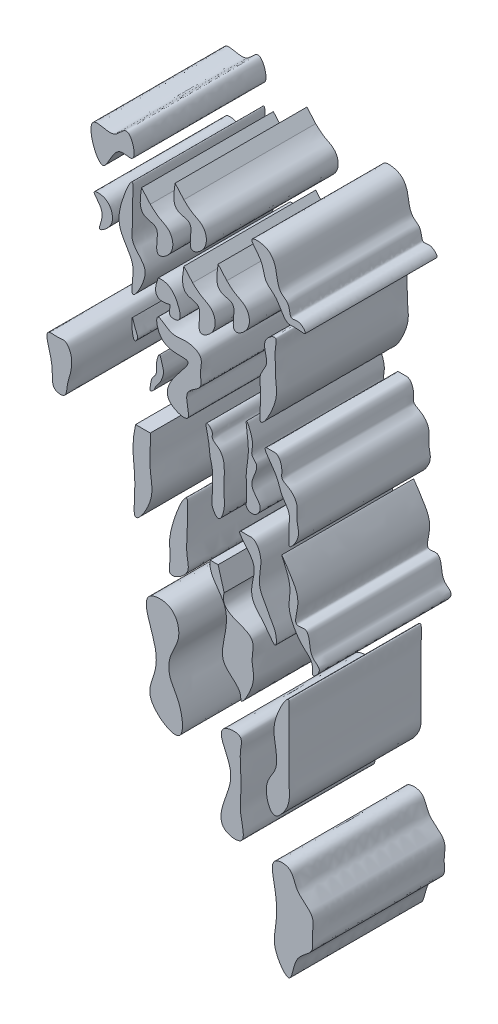
from build123d import *

# Parameters (mm, degrees)
BOSS_EXTRUDE1_DEPTH    = 4
BOSS_EXTRUDE1_2_DEPTH  = 4
BOSS_EXTRUDE1_3_DEPTH  = 4
BOSS_EXTRUDE1_4_DEPTH  = 4
BOSS_EXTRUDE1_5_DEPTH  = 4
BOSS_EXTRUDE1_6_DEPTH  = 4
BOSS_EXTRUDE1_7_DEPTH  = 4
BOSS_EXTRUDE1_8_DEPTH  = 4
BOSS_EXTRUDE1_9_DEPTH  = 4
BOSS_EXTRUDE1_10_DEPTH = 4
BOSS_EXTRUDE1_11_DEPTH = 4
BOSS_EXTRUDE1_12_DEPTH = 4
BOSS_EXTRUDE1_13_DEPTH = 4
BOSS_EXTRUDE1_14_DEPTH = 4
BOSS_EXTRUDE1_15_DEPTH = 4
BOSS_EXTRUDE1_16_DEPTH = 4
BOSS_EXTRUDE1_17_DEPTH = 4
BOSS_EXTRUDE1_18_DEPTH = 4
BOSS_EXTRUDE1_19_DEPTH = 4
BOSS_EXTRUDE1_20_DEPTH = 4
BOSS_EXTRUDE1_21_DEPTH = 4
BOSS_EXTRUDE1_22_DEPTH = 4
BOSS_EXTRUDE1_23_DEPTH = 4
BOSS_EXTRUDE1_24_DEPTH = 4
BOSS_EXTRUDE1_25_DEPTH = 4
BOSS_EXTRUDE1_26_DEPTH = 4


with BuildPart() as part:
    # Sketch2 → Boss-Extrude1 (new body)
    with BuildSketch(Plane.XY):
        with BuildLine():
            Line((-21.986335462, -41.867078251), (-22.252383941, -41.563360809))
            add(Edge.make_bspline(
                [(-22.252383941, -41.563360809), (-22.298472315, -41.861578773), (-22.366610204, -42.302469624), (-21.719633435, -42.325520445), (-21.795140074, -42.723708569), (-21.801445987, -43.195240069), (-21.218247997, -42.82832349), (-21.319505384, -42.245709932), (-21.745198937, -42.096377794), (-21.911165814, -41.938557948), (-21.986335462, -41.867078251)],
                knots=[0, 0, 0, 0, 0.207427307, 0.306664296, 0.423391703, 0.50552082, 0.625102619, 0.799711517, 0.909285425, 1, 1, 1, 1], degree=3))
        make_face()
    extrude(amount=BOSS_EXTRUDE1_DEPTH)


with BuildPart() as body_2:
    # Sketch2 → Boss-Extrude1 2 (new body)
    with BuildSketch(Plane.XY):
        with BuildLine():
            Line((-19.662457453, -42.71461023), (-19.928505932, -42.410892789))
            add(Edge.make_bspline(
                [(-19.928505932, -42.410892789), (-19.974594306, -42.709110752), (-20.042732194, -43.150001603), (-19.395755426, -43.173052425), (-19.471262065, -43.571240548), (-19.477567978, -44.042772048), (-18.894369988, -43.67585547), (-18.995627374, -43.093241911), (-19.421320928, -42.943909773), (-19.587287805, -42.786089928), (-19.662457453, -42.71461023)],
                knots=[0, 0, 0, 0, 0.207427307, 0.306664296, 0.423391703, 0.50552082, 0.625102619, 0.799711517, 0.909285425, 1, 1, 1, 1], degree=3))
        make_face()
    extrude(amount=BOSS_EXTRUDE1_2_DEPTH)


with BuildPart() as body_3:
    # Sketch2 → Boss-Extrude1 3 (new body)
    with BuildSketch(Plane.XY):
        with BuildLine():
            Line((-20.701367621, -43.288744797), (-20.967416101, -42.985027356))
            add(Edge.make_bspline(
                [(-20.967416101, -42.985027356), (-21.013504475, -43.283245319), (-21.081642363, -43.72413617), (-20.434665595, -43.747186992), (-20.510172234, -44.145375115), (-20.516478147, -44.616906615), (-19.933280157, -44.249990036), (-20.034537543, -43.667376478), (-20.460231096, -43.51804434), (-20.626197974, -43.360224495), (-20.701367621, -43.288744797)],
                knots=[0, 0, 0, 0, 0.207427307, 0.306664296, 0.423391703, 0.50552082, 0.625102619, 0.799711517, 0.909285425, 1, 1, 1, 1], degree=3))
        make_face()
    extrude(amount=BOSS_EXTRUDE1_3_DEPTH)


with BuildPart() as body_4:
    # Sketch2 → Boss-Extrude1 4 (new body)
    with BuildSketch(Plane.XY):
        with BuildLine():
            Line((-20.967416101, -41.238808198), (-21.23346458, -40.935090757))
            add(Edge.make_bspline(
                [(-21.23346458, -40.935090757), (-21.279552954, -41.23330872), (-21.347690843, -41.674199571), (-20.700714074, -41.697250393), (-20.776220713, -42.095438516), (-20.782526626, -42.566970016), (-20.199328636, -42.200053437), (-20.300586022, -41.617439879), (-20.726279576, -41.468107741), (-20.892246453, -41.310287895), (-20.967416101, -41.238808198)],
                knots=[0, 0, 0, 0, 0.207427307, 0.306664296, 0.423391703, 0.50552082, 0.625102619, 0.799711517, 0.909285425, 1, 1, 1, 1], degree=3))
        make_face()
    extrude(amount=BOSS_EXTRUDE1_4_DEPTH)


with BuildPart() as body_5:
    # Sketch2 → Boss-Extrude1 5 (new body)
    with BuildSketch(Plane.XY):
        with BuildLine():
            add(Edge.make_bspline(
                [(-23.68118214, -42.382997305), (-23.737073321, -42.439817834), (-23.257102059, -42.75520643), (-23.70139795, -43.471427128), (-23.175643709, -43.083143681), (-23.094900473, -42.726017087), (-23.271418547, -42.345807041), (-23.647460778, -42.348715231), (-23.68118214, -42.382997305)],
                knots=[0, 0, 0, 0, 0.189662322, 0.403883418, 0.562625618, 0.683862046, 0.885569215, 1, 1, 1, 1], degree=3))
        make_face()
    extrude(amount=BOSS_EXTRUDE1_5_DEPTH)


with BuildPart() as body_6:
    # Sketch2 → Boss-Extrude1 6 (new body)
    with BuildSketch(Plane.XY):
        with BuildLine():
            add(Edge.make_bspline(
                [(-23.05236809, -40.555314666), (-22.921397326, -40.483411989), (-22.630328363, -39.999500735), (-22.321663146, -41.103780518), (-23.117307183, -40.754654029), (-23.392421337, -42.284527412), (-24.015844419, -40.483500593), (-23.386988809, -40.559869883), (-23.176617867, -40.623527534), (-23.05236809, -40.555314666)],
                knots=[0, 0, 0, 0, 0.110138294, 0.274977823, 0.358566911, 0.575411854, 0.839787582, 0.89551364, 1, 1, 1, 1], degree=3))
        make_face()
    extrude(amount=BOSS_EXTRUDE1_6_DEPTH)


with BuildPart() as body_7:
    # Sketch2 → Boss-Extrude1 7 (new body)
    with BuildSketch(Plane.XY):
        with BuildLine():
            add(Edge.make_bspline(
                [(-22.532913006, -41.563360809), (-22.590677573, -41.531299761), (-22.949670309, -42.366385654), (-22.969863341, -43.032278711), (-22.460213199, -43.62490225), (-22.525441776, -44.081256962), (-22.580252653, -44.783458591), (-22.140611049, -44.012472959), (-22.137117074, -43.483853196), (-22.590376996, -43.230805363), (-22.512895688, -42.687813561), (-22.559840411, -42.275462041), (-22.480600408, -41.592395853), (-22.532913006, -41.563360809)],
                knots=[0, 0, 0, 0, 0.124790419, 0.252828034, 0.367115678, 0.450340127, 0.495153292, 0.620686035, 0.639891678, 0.758950007, 0.803763172, 0.886987622, 1, 1, 1, 1], degree=3))
        make_face()
    extrude(amount=BOSS_EXTRUDE1_7_DEPTH)


with BuildPart() as body_8:
    # Sketch2 → Boss-Extrude1 8 (new body)
    with BuildSketch(Plane.XY):
        with BuildLine():
            add(Edge.make_bspline(
                [(-21.748218975, -44.710955341), (-21.837771198, -44.740020199), (-21.7045509, -45.555112282), (-20.381618381, -45.199229818), (-21.4324039, -46.092432465), (-21.533943, -46.826608735), (-20.588160681, -47.125043046), (-21.105450624, -46.174669673), (-20.366921925, -45.997889383), (-20.509655171, -45.520112635), (-20.344004421, -45.071355562), (-20.918926217, -44.860710179), (-21.331116078, -45.03678209), (-21.680083167, -44.688841344), (-21.748218975, -44.710955341)],
                knots=[0, 0, 0, 0, 0.079194782, 0.197262076, 0.345976518, 0.419153876, 0.501785608, 0.599355418, 0.681342851, 0.730127756, 0.795174296, 0.860690626, 0.939744652, 1, 1, 1, 1], degree=3))
        make_face()
    extrude(amount=BOSS_EXTRUDE1_8_DEPTH)


with BuildPart() as body_9:
    # Sketch2 → Boss-Extrude1 9 (new body)
    with BuildSketch(Plane.XY):
        with BuildLine():
            add(Edge.make_bspline(
                [(-21.748218975, -43.685605608), (-22.006178502, -44.380112028), (-21.391044245, -44.201524663)],
                knots=[0, 0, 0, 1, 1, 1], degree=2))
            add(Edge.make_bspline(
                [(-21.391044245, -44.201524663), (-21.376935261, -44.309191711), (-21.503090251, -44.52834963), (-21.099724893, -44.544041202), (-21.071615595, -44.297323078), (-21.170013448, -43.998550273), (-21.361421395, -43.669741319), (-21.713865543, -43.668881688), (-21.748218975, -43.685605608)],
                knots=[0.768268496, 0.768268496, 0.768268496, 0.768268496, 0.886892453, 1, 1.067007808, 1.163276486, 1.415120514, 1.50032429, 1.50032429, 1.50032429, 1.50032429], degree=3))
        make_face()
    extrude(amount=BOSS_EXTRUDE1_9_DEPTH)


with BuildPart() as body_10:
    # Sketch2 → Boss-Extrude1 10 (new body)
    with BuildSketch(Plane.XY):
        with BuildLine():
            add(Edge.make_bspline(
                [(-18.896727415, -41.238808198), (-18.943620198, -41.308831083), (-18.519259496, -41.666134083), (-18.566270998, -42.147998326), (-18.075173598, -42.420663017), (-17.918275253, -42.982314881), (-17.552256958, -42.886789115), (-17.165316303, -42.986307194), (-17.452171962, -42.639278286), (-17.773124988, -42.798677076), (-17.738789556, -42.375053958), (-18.142320304, -42.19653355), (-18.123301743, -41.645976786), (-18.387286933, -41.194914757), (-18.858289707, -41.181410896), (-18.896727415, -41.238808198)],
                knots=[0, 0, 0, 0, 0.090893699, 0.198006008, 0.271353317, 0.397553121, 0.445449175, 0.493345228, 0.547007653, 0.589581923, 0.652417314, 0.703549173, 0.825265733, 0.925495028, 1, 1, 1, 1], degree=3))
        make_face()
    extrude(amount=BOSS_EXTRUDE1_10_DEPTH)


with BuildPart() as body_11:
    # Sketch2 → Boss-Extrude1 11 (new body)
    with BuildSketch(Plane.XY):
        with BuildLine():
            add(Edge.make_bspline(
                [(-18.185894142, -43.487175203), (-18.231846745, -43.442826317), (-18.696190335, -43.73972167), (-18.296271874, -44.251640337), (-18.683251608, -44.618884044), (-18.632691542, -45.07538334), (-18.634453348, -45.405482102), (-18.707906436, -46.232988357), (-18.045273381, -45.095678607), (-18.1965189, -44.636713718), (-18.177645779, -44.146839604), (-18.227376303, -43.87954742), (-18.153914748, -43.518038536), (-18.185894142, -43.487175203)],
                knots=[0, 0, 0, 0, 0.061537795, 0.185612455, 0.277415397, 0.320071355, 0.442707231, 0.506691167, 0.681349602, 0.806503316, 0.845202652, 0.95717454, 1, 1, 1, 1], degree=3))
        make_face()
    extrude(amount=BOSS_EXTRUDE1_11_DEPTH)


with BuildPart() as body_12:
    # Sketch2 → Boss-Extrude1 12 (new body)
    with BuildSketch(Plane.XY):
        with BuildLine():
            add(Edge.make_bspline(
                [(-20.262482599, -46.761435937), (-20.334783729, -46.758471735), (-20.17961393, -47.241615252), (-20.205476149, -47.528984505), (-20.081023169, -47.892509102), (-20.11853295, -48.218240939), (-20.087094027, -48.550476956), (-20.154260695, -48.846121307), (-19.886248342, -49.248428962), (-19.715205788, -48.741327686), (-19.750240889, -48.468757583), (-19.741306449, -48.181545904), (-19.749927058, -47.899830726), (-19.722882301, -47.558773764), (-19.83967125, -47.241498524), (-20.143811383, -47.105659747), (-20.067698205, -46.891998812), (-20.218671108, -46.763232121), (-20.262482599, -46.761435937)],
                knots=[0, 0, 0, 0, 0.07553121, 0.170308288, 0.228109535, 0.293871514, 0.369028061, 0.425395472, 0.484490328, 0.565557313, 0.621924723, 0.672029088, 0.734659544, 0.794158477, 0.87802002, 0.927742579, 0.954231214, 1, 1, 1, 1], degree=3))
        make_face()
    extrude(amount=BOSS_EXTRUDE1_12_DEPTH)


with BuildPart() as body_13:
    # Sketch2 → Boss-Extrude1 13 (new body)
    with BuildSketch(Plane.XY):
        with BuildLine():
            add(Edge.make_bspline(
                [(-19.067166236, -46.104002927), (-19.095519908, -46.111793064), (-19.009798549, -46.635862487), (-18.999132189, -46.974030438), (-19.087420252, -47.450952273), (-19.073490808, -47.835114926), (-19.049031318, -48.146117899), (-19.102672106, -48.384734417), (-18.83150345, -48.523032912), (-18.492887741, -48.118434906), (-18.912888716, -47.872156886), (-18.900990897, -47.461061547), (-18.63791884, -47.134896533), (-18.929432785, -46.939520873), (-18.886841839, -46.720813288), (-18.866520812, -46.479944796), (-19.036413451, -46.095553636), (-19.067166236, -46.104002927)],
                knots=[0, 0, 0, 0, 0.079148829, 0.188966448, 0.25713944, 0.355437454, 0.416873712, 0.447591842, 0.486056184, 0.555274674, 0.659524401, 0.687170717, 0.79677169, 0.830363006, 0.862856249, 0.914154087, 1, 1, 1, 1], degree=3))
        make_face()
    extrude(amount=BOSS_EXTRUDE1_13_DEPTH)


with BuildPart() as body_14:
    # Sketch2 → Boss-Extrude1 14 (new body)
    with BuildSketch(Plane.XY):
        with BuildLine():
            add(Edge.make_bspline(
                [(-18.459291555, -46.502464629), (-18.607317053, -46.530797749), (-18.093786404, -47.065459578), (-18.057589687, -47.494817637), (-17.726759369, -47.836520005), (-17.79553672, -48.25605929), (-17.76253241, -48.499036775), (-17.794268937, -48.861617077), (-17.396031252, -48.355266718), (-17.547451973, -48.069052021), (-17.531506428, -47.774736449), (-17.517300163, -47.495978756), (-17.689892888, -47.231965709), (-18.02282498, -47.11622089), (-17.967653002, -46.81367542), (-18.068701293, -46.46634304), (-18.319292429, -46.509896128), (-18.426888488, -46.496262455), (-18.459291555, -46.502464629)],
                knots=[0, 0, 0, 0, 0.118684727, 0.212554465, 0.298046987, 0.357615413, 0.44101121, 0.458881738, 0.530348682, 0.619701322, 0.667356064, 0.694161856, 0.779853247, 0.833126039, 0.858319634, 0.947491069, 0.974019685, 1, 1, 1, 1], degree=3))
        make_face()
    extrude(amount=BOSS_EXTRUDE1_14_DEPTH)


with BuildPart() as body_15:
    # Sketch2 → Boss-Extrude1 15 (new body)
    with BuildSketch(Plane.XY):
        with BuildLine():
            add(Edge.make_bspline(
                [(-22.532945929, -45.121059609), (-22.569722647, -45.130350819), (-22.53625296, -45.91072222), (-22.342358304, -45.544330196), (-22.452874537, -45.392774724), (-22.512196327, -45.115923971), (-22.53293496, -45.121056838), (-22.532945929, -45.121059609)],
                knots=[0.514864485, 0.514864485, 0.514864485, 0.514864485, 1, 1.118853239, 1.24143454, 1.514719792, 1.514864485, 1.514864485, 1.514864485, 1.514864485], degree=3))
        make_face()
    extrude(amount=BOSS_EXTRUDE1_15_DEPTH)


with BuildPart() as body_16:
    # Sketch2 → Boss-Extrude1 16 (new body)
    with BuildSketch(Plane.XY):
        with BuildLine():
            add(Edge.make_bspline(
                [(-21.702473758, -45.684002753), (-21.732193882, -45.680148085), (-21.841585912, -45.988147379), (-21.749571569, -46.215523849), (-21.966529984, -46.429781527), (-21.970647929, -46.578174547), (-22.018439679, -46.804904697), (-21.859438898, -46.700882326), (-21.835927782, -46.558270765), (-21.698190557, -46.434370036), (-21.624025484, -46.25963168), (-21.561751102, -46.06635404), (-21.637064515, -45.901767284), (-21.673421357, -45.687770819), (-21.702473758, -45.684002753)],
                knots=[0, 0, 0, 0, 0.092912224, 0.25554589, 0.331586786, 0.430138251, 0.480228307, 0.526797268, 0.585231648, 0.673735129, 0.742868481, 0.830191707, 0.909175241, 1, 1, 1, 1], degree=3))
        make_face()
    extrude(amount=BOSS_EXTRUDE1_16_DEPTH)


with BuildPart() as body_17:
    # Sketch2 → Boss-Extrude1 17 (new body)
    with BuildSketch(Plane.XY):
        with BuildLine():
            add(Edge.make_bspline(
                [(-19.241242608, -49.088158003), (-19.385758358, -49.120645444), (-18.677205616, -49.702181463), (-18.90706467, -50.183012597), (-18.923729207, -50.806234643), (-18.571296533, -51.043232809), (-18.142196515, -51.737987706), (-18.159562193, -51.194176071), (-18.328322013, -50.973935337), (-18.47026966, -50.649161221), (-18.708325869, -50.312109744), (-18.653611492, -49.846193788), (-18.595742772, -49.433186777), (-18.811641683, -49.050871247), (-19.061524962, -49.098206697), (-19.203620137, -49.079700393), (-19.241242608, -49.088158003)],
                knots=[0, 0, 0, 0, 0.115157859, 0.226820089, 0.281142255, 0.413350591, 0.482986084, 0.53730825, 0.591136238, 0.642047568, 0.716172115, 0.797655364, 0.870084918, 0.940667278, 0.970020408, 1, 1, 1, 1], degree=3))
        make_face()
    extrude(amount=BOSS_EXTRUDE1_17_DEPTH)


with BuildPart() as body_18:
    # Sketch2 → Boss-Extrude1 18 (new body)
    with BuildSketch(Plane.XY):
        with BuildLine():
            add(Edge.make_bspline(
                [(-17.994515953, -49.088158003), (-18.024924398, -49.061644981), (-17.640209476, -49.765885274), (-17.863175831, -50.298997318), (-17.608596879, -50.891973877), (-17.293081927, -51.248881516), (-17.018382999, -51.446672462), (-17.117523428, -51.919377835), (-16.73947771, -51.528579654), (-17.119072763, -51.33766791), (-17.136902602, -51.026927405), (-17.217839312, -50.618892222), (-17.65615351, -50.785830169), (-17.416144317, -50.002405244), (-17.608703845, -49.672575848), (-17.974982474, -49.105189178), (-17.994515953, -49.088158003)],
                knots=[0, 0, 0, 0, 0.099615464, 0.20490965, 0.317531288, 0.378111709, 0.440135327, 0.477239873, 0.52570191, 0.566148169, 0.635447654, 0.682907344, 0.722866922, 0.785474276, 0.936009994, 1, 1, 1, 1], degree=3))
        make_face()
    extrude(amount=BOSS_EXTRUDE1_18_DEPTH)


with BuildPart() as body_19:
    # Sketch2 → Boss-Extrude1 19 (new body)
    with BuildSketch(Plane.XY):
        with BuildLine():
            add(Edge.make_bspline(
                [(-17.775798023, -52.797998542), (-17.838175988, -52.707112984), (-18.320718484, -53.5760396), (-18.188528499, -54.137311989), (-18.098552265, -54.871728047), (-18.612675551, -55.28980636), (-18.320503033, -56.218073651), (-17.908971472, -55.815098537), (-17.735048884, -55.459601542), (-17.78623335, -54.975676225), (-17.772114631, -54.493827783), (-17.777948091, -53.992204743), (-17.77269212, -53.566541807), (-17.781709454, -53.198357915), (-17.738405638, -52.852479763), (-17.775798023, -52.797998542)],
                knots=[0, 0, 0, 0, 0.117997798, 0.224098221, 0.30809439, 0.405103613, 0.506158499, 0.541785397, 0.615385964, 0.681698729, 0.748011494, 0.827586812, 0.902741278, 0.929266384, 1, 1, 1, 1], degree=3))
        make_face()
    extrude(amount=BOSS_EXTRUDE1_19_DEPTH)


with BuildPart() as body_20:
    # Sketch2 → Boss-Extrude1 20 (new body)
    with BuildSketch(Plane.XY):
        with BuildLine():
            Line((-19.928505932, -50.309603916), (-20.169436407, -50.309603916))
            add(Edge.make_bspline(
                [(-20.169436407, -50.309603916), (-20.229671124, -50.700877062), (-19.569660718, -51.161999169), (-19.717044709, -52.059952868), (-19.905254167, -52.922549941), (-19.23121436, -53.181303106), (-19.248817411, -53.702910161), (-18.703307231, -52.793047979), (-18.977858073, -52.403387274), (-18.686108994, -51.427825611), (-19.920063105, -51.55499757), (-19.744259395, -50.957970167)],
                knots=[0, 0, 0, 0, 0.161308172, 0.30160602, 0.400049989, 0.529280213, 0.533968021, 0.629861713, 0.737681299, 0.815344822, 1, 1, 1, 1], degree=3))
            Line((-19.744259395, -50.957970167), (-19.928505932, -50.309603916))
        make_face()
    extrude(amount=BOSS_EXTRUDE1_20_DEPTH)


with BuildPart() as body_21:
    # Sketch2 → Boss-Extrude1 21 (new body)
    with BuildSketch(Plane.XY):
        with BuildLine():
            add(Edge.make_bspline(
                [(-25.042610131, -46.761435937), (-25.243810487, -46.809624263), (-24.842766392, -47.534515145), (-25.035707999, -48.214016693), (-24.519006836, -48.246354266), (-24.52431042, -47.875876982), (-24.388396001, -47.491392204), (-24.316199372, -47.067187235), (-24.561529899, -46.717353876), (-24.79923434, -46.781422202), (-24.982489336, -46.747036755), (-25.042610131, -46.761435937)],
                knots=[0, 0, 0, 0, 0.229294116, 0.398763636, 0.457491214, 0.55100523, 0.629583477, 0.813319084, 0.872756913, 0.931484492, 1, 1, 1, 1], degree=3))
        make_face()
    extrude(amount=BOSS_EXTRUDE1_21_DEPTH)


with BuildPart() as body_22:
    # Sketch2 → Boss-Extrude1 22 (new body)
    with BuildSketch(Plane.XY):
        with BuildLine():
            Line((-21.986335462, -47.878557504), (-22.433560417, -47.878557504))
            add(Edge.make_bspline(
                [(-22.433560417, -47.878557504), (-22.609174968, -48.657684749), (-22.359952515, -49.006739045), (-22.556758237, -50.678094474), (-21.816019213, -49.572967195), (-22.051822798, -48.830073173), (-21.971698231, -48.197150089), (-21.986335462, -47.878557504)],
                knots=[0, 0, 0, 0, 0.356745645, 0.486392678, 0.643781798, 0.804777181, 1, 1, 1, 1], degree=3))
        make_face()
    extrude(amount=BOSS_EXTRUDE1_22_DEPTH)


with BuildPart() as body_23:
    # Sketch2 → Boss-Extrude1 23 (new body)
    with BuildSketch(Plane.XY):
        with BuildLine():
            add(Edge.make_bspline(
                [(-21.986335462, -52.16210896), (-22.298986348, -52.373853087), (-21.71224818, -53.345262096), (-21.842251388, -54.168796883), (-22.196444884, -54.943536489), (-20.882779103, -55.845835547), (-21.035677127, -54.517580487), (-21.435034757, -54.050818149), (-21.433264953, -53.380830745), (-21.004581892, -52.866406563), (-21.254248503, -52.042813484), (-21.84762376, -52.068165877), (-21.986335462, -52.16210896)],
                knots=[0, 0, 0, 0, 0.174156446, 0.268833852, 0.34454349, 0.481087077, 0.595065837, 0.673723147, 0.73660798, 0.83332232, 0.922733189, 1, 1, 1, 1], degree=3))
        make_face()
    extrude(amount=BOSS_EXTRUDE1_23_DEPTH)


with BuildPart() as body_24:
    # Sketch2 → Boss-Extrude1 24 (new body)
    with BuildSketch(Plane.XY):
        with BuildLine():
            add(Edge.make_bspline(
                [(-20.860111946, -49.088158003), (-20.910329657, -48.817553733), (-21.533184493, -50.256495168), (-21.341512558, -50.78387788), (-21.487273642, -51.469268381), (-20.753771057, -51.048346074), (-20.931420634, -50.417248517), (-20.849769383, -49.885714282), (-20.86518717, -49.402321926), (-20.847753967, -49.15475048), (-20.860111946, -49.088158003)],
                knots=[0, 0, 0, 0, 0.27999293, 0.416298245, 0.478925011, 0.606911473, 0.676906094, 0.879522102, 0.931097085, 1, 1, 1, 1], degree=3))
        make_face()
    extrude(amount=BOSS_EXTRUDE1_24_DEPTH)


with BuildPart() as body_25:
    # Sketch2 → Boss-Extrude1 25 (new body)
    with BuildSketch(Plane.XY):
        with BuildLine():
            add(Edge.make_bspline(
                [(-19.744259395, -54.52398455), (-19.976531641, -54.692085538), (-19.279289093, -55.612159395), (-19.791734781, -56.311097866), (-19.90141227, -57.229493829), (-19.00064796, -57.350273158), (-19.291164463, -56.55943433), (-19.228973532, -56.007358255), (-19.229896249, -55.3985565), (-19.283367099, -54.935439995), (-19.153944681, -54.390462106), (-19.613331396, -54.429228821), (-19.744259395, -54.52398455)],
                knots=[0, 0, 0, 0, 0.140072209, 0.33285562, 0.417852888, 0.497609647, 0.604682651, 0.683394006, 0.783206847, 0.878266696, 0.921043628, 1, 1, 1, 1], degree=3))
        make_face()
    extrude(amount=BOSS_EXTRUDE1_25_DEPTH)


with BuildPart() as body_26:
    # Sketch2 → Boss-Extrude1 26 (new body)
    with BuildSketch(Plane.XY):
        with BuildLine():
            add(Edge.make_bspline(
                [(-18.185894142, -57.221605955), (-18.345340077, -57.333221567), (-18.143106175, -58.08914947), (-18.13477849, -58.798575702), (-18.305663822, -59.532032778), (-17.673453462, -60.430214865), (-17.655346764, -59.333195048), (-16.992584979, -59.134342829), (-17.104563947, -58.593879785), (-16.943471091, -58.047237803), (-17.597107847, -57.774557977), (-17.652805464, -57.147220499), (-18.084862268, -57.150881452), (-18.185894142, -57.221605955)],
                knots=[0, 0, 0, 0, 0.095644421, 0.254903064, 0.345099579, 0.445133034, 0.54238347, 0.643214081, 0.690965153, 0.765244598, 0.866075208, 0.939395538, 1, 1, 1, 1], degree=3))
        make_face()
    extrude(amount=BOSS_EXTRUDE1_26_DEPTH)


solid = Compound([part.part, body_2.part, body_3.part, body_4.part, body_5.part, body_6.part, body_7.part, body_8.part, body_9.part, body_10.part, body_11.part, body_12.part, body_13.part, body_14.part, body_15.part, body_16.part, body_17.part, body_18.part, body_19.part, body_20.part, body_21.part, body_22.part, body_23.part, body_24.part, body_25.part, body_26.part])
